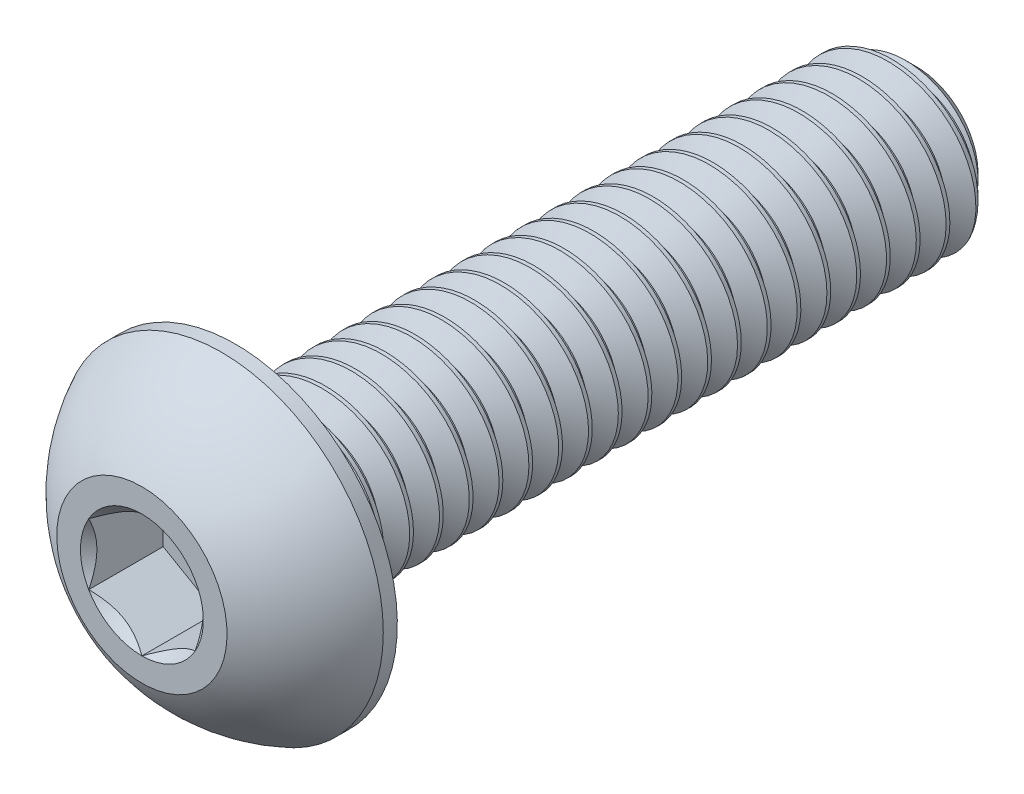
from build123d import *

# Parameters (mm, degrees)
CUT_EXTRUDE1_DEPTH = 1.75
CUT_SWEEP1_PITCH   = 0.7
CUT_SWEEP1_TO      = 16


with BuildPart() as part:
    # Sketch2 → Revolve1 (revolve)
    with BuildSketch(Plane(origin=(0, 0, 0), x_dir=(0, 0, -1), z_dir=(1, 0, 0)), mode=Mode.PRIVATE) as revolve1_sk:
        with BuildLine():
            Line((-9.1, 0), (9.1, 0))
            Line((9.1, 0), (9.1, 1.44))
            Line((9.1, 1.44), (8.54, 2))
            Line((8.54, 2), (-6.9, 2))
            Line((-6.9, 2), (-6.9, 3.8))
            Line((-6.9, 3.8), (-7.23, 3.8))
            ThreePointArc((-7.23, 3.8), (-8.306499853, 3.047002626), (-9.1, 2))
            Line((-9.1, 2), (-9.1, 0))
        make_face()
    revolve(revolve1_sk.sketch.rotate(Axis((0, 0, 9.1), (0, 0, -1)), 180), axis=Axis((0, 0, 9.1), (0, 0, -1)))

    # Sketch3 → Cut-Extrude1 (cut)
    with BuildSketch(Plane.XY.offset(9.1)):
        Polygon((0, 1.443375673), (-1.25, 0.721687836), (-1.25, -0.721687836), (0, -1.443375673), (1.25, -0.721687836), (1.25, 0.721687836), align=None)
    extrude(amount=-CUT_EXTRUDE1_DEPTH, mode=Mode.SUBTRACT)

    # Cut-Extrude2 cone 1 section (through the dimple's axis) → Cut-Extrude2 (revolve, cut)
    with BuildSketch(Plane(origin=(0, 0, 9.1), x_dir=(0, -1, 0), z_dir=(1, 0, 0))):
        Polygon((0, 0), (1.443375673, 0), (0, 1.443375673), align=None)
    revolve(axis=Axis((0, 0, 9.1), (0, 0, -1)), mode=Mode.SUBTRACT)


with BuildPart() as body_2:
    # Split1: read off the stored shape, not the designer's step
    # Split1: the piece on the far side of the plane
    add(part.part)
    split(bisect_by=Plane.XY.offset(6.9), keep=Keep.BOTTOM)

    # Cut-Sweep1: arcs per turn and ends read off the stored shape
    # Cut-Sweep1: the profile of Sketch6 screwed along a right-hand helix through 23.857143 turns, 6 arcs to a turn; built about Z, then put on its axis
    cut_sweep1_z = Axis((0, 0, 0), (0, 0, 1))
    cut_sweep1_corners = [(1.545336663, 0, -0.2625), (1.545336663, 0, -0.35), (2.037888611, 0, -0.634375), (2.037888611, 0, 0.021875)]
    with BuildLine(mode=Mode.PRIVATE) as cut_sweep1_profile:
        Line(cut_sweep1_corners[0], cut_sweep1_corners[1])
        Line(cut_sweep1_corners[1], cut_sweep1_corners[2])
        Line(cut_sweep1_corners[2], cut_sweep1_corners[3])
        Line(cut_sweep1_corners[3], cut_sweep1_corners[0])
    cut_sweep1_cap = Face(cut_sweep1_profile.wire())
    cut_sweep1_turn_angles = [0, 30, 60, 90, 120, 150, 180, 210, 240, 270, 300, 330, 360]
    cut_sweep1_turn_weights = [1, 0.8660254037844387, 1, 0.8660254037844387, 1, 0.8660254037844387, 1, 0.8660254037844387, 1, 0.8660254037844387, 1, 0.8660254037844387, 1]
    cut_sweep1_turn_rails = [Edge.make_bspline([Vector(p[0], p[1], 0).rotate(cut_sweep1_z, cut_sweep1_turn_angles[k]) / cut_sweep1_turn_weights[k] + Vector(0, 0, p[2] + CUT_SWEEP1_PITCH * cut_sweep1_turn_angles[k] / 360) for k in range(13)], [0, 0, 0, 1, 1, 2, 2, 3, 3, 4, 4, 5, 5, 6, 6, 6], 2, cut_sweep1_turn_weights) for p in cut_sweep1_corners]
    cut_sweep1_turn_sides = [Face.make_surface_from_curves(cut_sweep1_turn_rails[p[0]], cut_sweep1_turn_rails[p[1]]) for p in [(0, 1), (1, 2), (2, 3), (3, 0)]]
    cut_sweep1_last_angles = [8280, 8310, 8340, 8370, 8400, 8430, 8460, 8490, 8520, 8550, 8580, 8584.285714286, 8588.571428571]
    cut_sweep1_last_weights = [1, 0.8660254037844387, 1, 0.8660254037844387, 1, 0.8660254037844387, 1, 0.8660254037844387, 1, 0.8660254037844387, 1, 0.997203797181201, 1]
    cut_sweep1_last_rails = [Edge.make_bspline([Vector(p[0], p[1], 0).rotate(cut_sweep1_z, cut_sweep1_last_angles[k]) / cut_sweep1_last_weights[k] + Vector(0, 0, p[2] + CUT_SWEEP1_PITCH * cut_sweep1_last_angles[k] / 360) for k in range(13)], [0, 0, 0, 1, 1, 2, 2, 3, 3, 4, 4, 5, 5, 6, 6, 6], 2, cut_sweep1_last_weights) for p in cut_sweep1_corners]
    cut_sweep1_last_sides = [Face.make_surface_from_curves(cut_sweep1_last_rails[p[0]], cut_sweep1_last_rails[p[1]]) for p in [(0, 1), (1, 2), (2, 3), (3, 0)]]
    cut_sweep1 = Plane(origin=(0, 0, -9.1), x_dir=(0, 1, 0), z_dir=(0, 0, 1)) * split(Solid(Shell([*[p.moved(Location((0, 0, CUT_SWEEP1_PITCH * i))) for i in range(23) for p in cut_sweep1_turn_sides], *cut_sweep1_last_sides, cut_sweep1_cap, cut_sweep1_cap.rotate(cut_sweep1_z, 8588.571428571).moved(Location((0, 0, CUT_SWEEP1_PITCH * 8588.571428571 / 360)))])), bisect_by=Plane.XY.offset(CUT_SWEEP1_TO), keep=Keep.BOTTOM, mode=Mode.PRIVATE)
    add(cut_sweep1, mode=Mode.SUBTRACT)


with BuildPart() as part_1:
    add(part.part)

    # Split1
    split(bisect_by=Plane.XY.offset(6.9), keep=Keep.TOP)

    add(body_2.part)  # Boss-Extrude1 merges body 2
    # Boss-Extrude1: read off the stored shape, not the designer's step
    # Boss-Extrude1 outline → Boss-Extrude1 (revolve)
    with BuildSketch(Plane.XZ):
        Polygon((1.545334255, 6.9), (1.545334255, 6.112495829), (2, 6.9), align=None)
    revolve(axis=Axis((0, 0, 0), (0, 0, 1)))


solid = part_1.part
